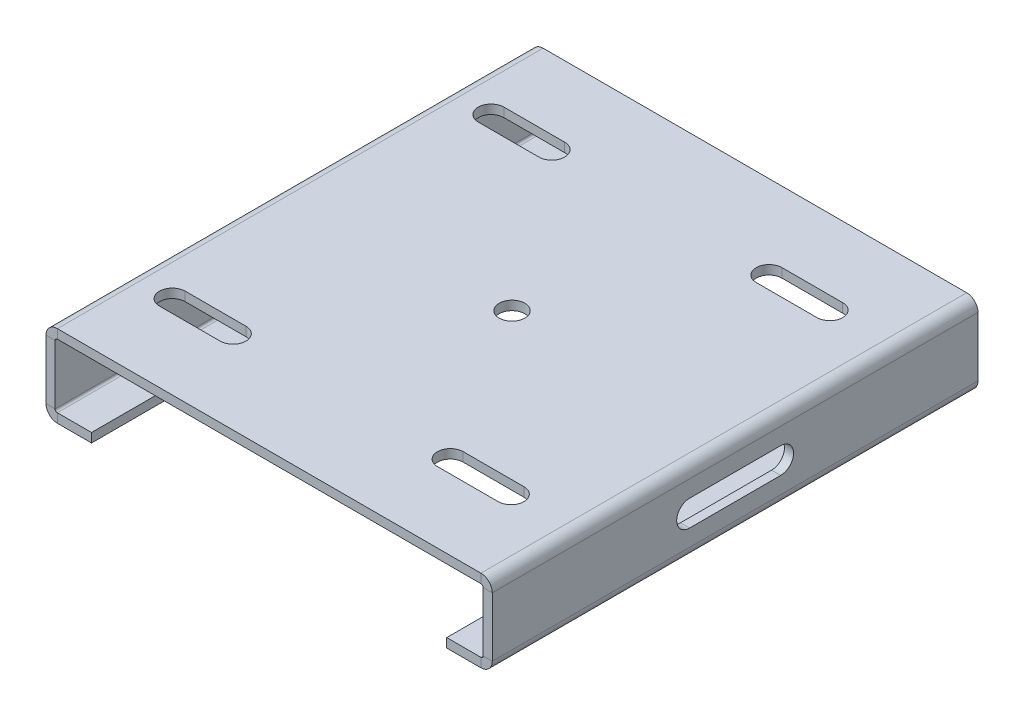
from build123d import *

# Parameters (mm, degrees)
SKETCH1_W                      = 141
SKETCH1_H                      = 160
BASE_FLANGE3_DEPTH             = 3
EDGE_FLANGE6_STRIP_W           = 13.4732
EDGE_FLANGE6_STRIP_H           = 3
EDGE_FLANGE6_STRIP_CUT_DEPTH   = 160
EDGE_FLANGE6_STRIP_2_W         = 13.4732
EDGE_FLANGE6_STRIP_2_H         = 3
EDGE_FLANGE6_STRIP_CUT_2_DEPTH = 160
EDGE_FLANGE6_DEPTH             = 160
EDGE_FLANGE6_BEND_DEPTH        = 160
EDGE_FLANGE8_STRIP_W           = 13.4732
EDGE_FLANGE8_STRIP_H           = 3
EDGE_FLANGE8_STRIP_CUT_DEPTH   = 160
EDGE_FLANGE8_STRIP_2_W         = 13.4732
EDGE_FLANGE8_STRIP_2_H         = 3
EDGE_FLANGE8_STRIP_CUT_2_DEPTH = 160
EDGE_FLANGE8_DEPTH             = 160
EDGE_FLANGE8_BEND_DEPTH        = 160
SKETCH76_R                     = 4.25
CUT_EXTRUDE1_DEPTH             = 10
CUT_EXTRUDE3_START             = -10
SKETCH80_R                     = 4.25
CUT_EXTRUDE3_DEPTH             = 10
CUT_EXTRUDE4_DEPTH             = 10
SKETCH85_R                     = 4.25
CUT_EXTRUDE5_DEPTH             = 10


# Sheet-metal steps are written as plain solids
with BuildPart() as part:
    # Sketch1 → Base-Flange3 (new body)
    with BuildSketch(Plane(origin=(0, 0, 0), x_dir=(1, 0, 0), z_dir=(0, 1, 0))):
        Rectangle(SKETCH1_W, SKETCH1_H)
    extrude(amount=-BASE_FLANGE3_DEPTH)

    # Edge-Flange6 strip (across the edge) → Edge-Flange6 strip cut (cut)
    with BuildSketch(Plane(origin=(-70.5, -3, 80), x_dir=(1, 0, 0), z_dir=(0, 0, -1))):
        with Locations((-6, -1.5)):
            Rectangle(EDGE_FLANGE6_STRIP_W, EDGE_FLANGE6_STRIP_H)
    extrude(amount=EDGE_FLANGE6_STRIP_CUT_DEPTH, mode=Mode.SUBTRACT)

    # Edge-Flange6 strip 2 (across the edge) → Edge-Flange6 strip cut 2 (cut)
    with BuildSketch(Plane(origin=(70.5, -3, -80), x_dir=(-1, 0, 0), z_dir=(0, 0, 1))):
        with Locations((-6, -1.5)):
            Rectangle(EDGE_FLANGE6_STRIP_2_W, EDGE_FLANGE6_STRIP_2_H)
    extrude(amount=EDGE_FLANGE6_STRIP_CUT_2_DEPTH, mode=Mode.SUBTRACT)

    # Edge-Flange6 section (across the edge) → Edge-Flange6 (add)
    with BuildSketch(Plane(origin=(-70.5, -3, 80), x_dir=(1, 0, 0), z_dir=(0, 0, -1))):
        with BuildLine():
            Line((-3, 0.7366), (-3, 21))
            Line((-3, 21), (0, 21))
            Line((0, 21), (0, 0.7366))
            ThreePointArc((0, 0.7366), (0.215745145, 0.215745145), (0.7366, 0))
            Line((0.7366, 0), (0.7366, -3))
            ThreePointArc((0.7366, -3), (-1.905575199, -1.905575199), (-3, 0.7366))
        make_face()
    extrude(amount=EDGE_FLANGE6_DEPTH)

    # Edge-Flange6 section 2 (across the edge) → Edge-Flange6 bend (add)
    with BuildSketch(Plane(origin=(70.5, -3, -80), x_dir=(-1, 0, 0), z_dir=(0, 0, 1))):
        with BuildLine():
            Line((-3, 0.7366), (-3, 21))
            Line((-3, 21), (0, 21))
            Line((0, 21), (0, 0.7366))
            ThreePointArc((0, 0.7366), (0.215745145, 0.215745145), (0.7366, 0))
            Line((0.7366, 0), (0.7366, -3))
            ThreePointArc((0.7366, -3), (-1.905575199, -1.905575199), (-3, 0.7366))
        make_face()
    extrude(amount=EDGE_FLANGE6_BEND_DEPTH)

    # Edge-Flange8 strip (across the edge) → Edge-Flange8 strip cut (cut)
    with BuildSketch(Plane(origin=(-70.5, -24, 80), x_dir=(0, 1, 0), z_dir=(0, 0, -1))):
        with Locations((-6, -1.5)):
            Rectangle(EDGE_FLANGE8_STRIP_W, EDGE_FLANGE8_STRIP_H)
    extrude(amount=EDGE_FLANGE8_STRIP_CUT_DEPTH, mode=Mode.SUBTRACT)

    # Edge-Flange8 strip 2 (across the edge) → Edge-Flange8 strip cut 2 (cut)
    with BuildSketch(Plane(origin=(70.5, -24, -80), x_dir=(0, 1, 0), z_dir=(0, 0, 1))):
        with Locations((-6, -1.5)):
            Rectangle(EDGE_FLANGE8_STRIP_2_W, EDGE_FLANGE8_STRIP_2_H)
    extrude(amount=EDGE_FLANGE8_STRIP_CUT_2_DEPTH, mode=Mode.SUBTRACT)

    # Edge-Flange8 section (across the edge) → Edge-Flange8 (add)
    with BuildSketch(Plane(origin=(-70.5, -24, 80), x_dir=(0, 1, 0), z_dir=(0, 0, -1))):
        with BuildLine():
            Line((-3, 0.7366), (-3, 12))
            Line((-3, 12), (0, 12))
            Line((0, 12), (0, 0.7366))
            ThreePointArc((0, 0.7366), (0.215745145, 0.215745145), (0.7366, 0))
            Line((0.7366, 0), (0.7366, -3))
            ThreePointArc((0.7366, -3), (-1.905575199, -1.905575199), (-3, 0.7366))
        make_face()
    extrude(amount=EDGE_FLANGE8_DEPTH)

    # Edge-Flange8 section 2 (across the edge) → Edge-Flange8 bend (add)
    with BuildSketch(Plane(origin=(70.5, -24, -80), x_dir=(0, 1, 0), z_dir=(0, 0, 1))):
        with BuildLine():
            Line((-3, 0.7366), (-3, 12))
            Line((-3, 12), (0, 12))
            Line((0, 12), (0, 0.7366))
            ThreePointArc((0, 0.7366), (0.215745145, 0.215745145), (0.7366, 0))
            Line((0.7366, 0), (0.7366, -3))
            ThreePointArc((0.7366, -3), (-1.905575199, -1.905575199), (-3, 0.7366))
        make_face()
    extrude(amount=EDGE_FLANGE8_BEND_DEPTH)

    # Sketch76 → Cut-Extrude1 (cut)
    with BuildSketch(Plane.ZY.offset(73.5)):
        with Locations((-15, -13.5)):
            Circle(SKETCH76_R)
        with BuildLine():
            Line((15, -9.25), (-15, -9.25))
            ThreePointArc((-15, -9.25), (-11.99479618, -10.49479618), (-10.75, -13.5))
            ThreePointArc((-10.75, -13.5), (-11.99479618, -16.50520382), (-15, -17.75))
            Line((-15, -17.75), (15, -17.75))
            ThreePointArc((15, -17.75), (10.75, -13.5), (15, -9.25))
        make_face()
        with Locations((15, -13.5)):
            Circle(SKETCH76_R)
    extrude(amount=-CUT_EXTRUDE1_DEPTH, mode=Mode.SUBTRACT)

    # Sketch80 → Cut-Extrude3 (cut)
    with BuildSketch(Plane(origin=(73.5, 0, 0), x_dir=(0, 0, -1), z_dir=(1, 0, 0)).offset(CUT_EXTRUDE3_START)):
        with Locations((-15, -13.5)):
            Circle(SKETCH80_R)
        with BuildLine():
            Line((15, -9.25), (-15, -9.25))
            ThreePointArc((-15, -9.25), (-11.99479618, -10.49479618), (-10.75, -13.5))
            ThreePointArc((-10.75, -13.5), (-11.99479618, -16.50520382), (-15, -17.75))
            Line((-15, -17.75), (15, -17.75))
            ThreePointArc((15, -17.75), (10.75, -13.5), (15, -9.25))
        make_face()
        with Locations((15, -13.5)):
            Circle(SKETCH80_R)
    extrude(amount=CUT_EXTRUDE3_DEPTH, mode=Mode.SUBTRACT)

    # Sketch84 → Cut-Extrude4 (cut)
    with BuildSketch(Plane(origin=(0, 0, 0), x_dir=(1, 0, 0), z_dir=(0, 1, 0))):
        with BuildLine():
            Line((32.190582692, -56.75), (52.190582692, -56.75))
            ThreePointArc((52.190582692, -56.75), (56.440582692, -52.5), (52.190582692, -48.25))
            Line((52.190582692, -48.25), (32.190582692, -48.25))
            ThreePointArc((32.190582692, -48.25), (27.940582692, -52.5), (32.190582692, -56.75))
        make_face()
        with BuildLine():
            Line((-59.384714022, -56.75), (-39.384714022, -56.75))
            ThreePointArc((-39.384714022, -56.75), (-35.134714022, -52.5), (-39.384714022, -48.25))
            Line((-39.384714022, -48.25), (-59.384714022, -48.25))
            ThreePointArc((-59.384714022, -48.25), (-63.634714022, -52.5), (-59.384714022, -56.75))
        make_face()
        with BuildLine():
            Line((-59.384714022, 48.25), (-39.384714022, 48.25))
            ThreePointArc((-39.384714022, 48.25), (-35.134714022, 52.5), (-39.384714022, 56.75))
            Line((-39.384714022, 56.75), (-59.384714022, 56.75))
            ThreePointArc((-59.384714022, 56.75), (-63.634714022, 52.5), (-59.384714022, 48.25))
        make_face()
        with BuildLine():
            Line((32.190582692, 48.25), (52.190582692, 48.25))
            ThreePointArc((52.190582692, 48.25), (56.440582692, 52.5), (52.190582692, 56.75))
            Line((52.190582692, 56.75), (32.190582692, 56.75))
            ThreePointArc((32.190582692, 56.75), (27.940582692, 52.5), (32.190582692, 48.25))
        make_face()
    extrude(amount=-CUT_EXTRUDE4_DEPTH, mode=Mode.SUBTRACT)

    # Sketch85 → Cut-Extrude5 (cut)
    with BuildSketch(Plane.XZ.offset(3)):
        with Locations(Location((0, 0, 0), (0, 0, 270))):
            Circle(SKETCH85_R)
    extrude(amount=-CUT_EXTRUDE5_DEPTH, mode=Mode.SUBTRACT)


solid = part.part
